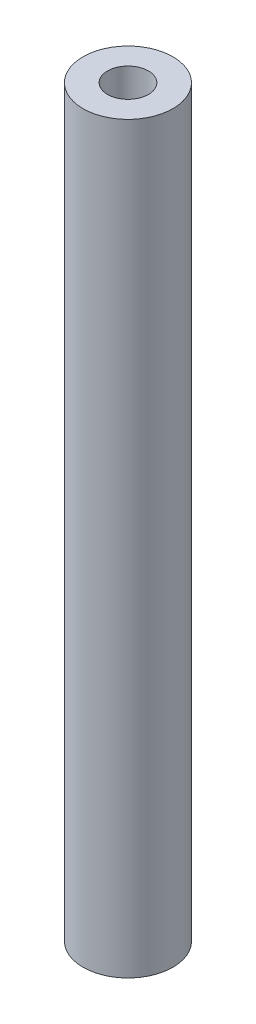
from build123d import *

# Parameters (mm, degrees)
SKETCH1_R           = 5.5
SKETCH1_R_2         = 2.5
BOSS_EXTRUDE1_DEPTH = 91


with BuildPart() as part:
    # Sketch1 → Boss-Extrude1 (new body)
    with BuildSketch(Plane(origin=(0, 0, 0), x_dir=(1, 0, 0), z_dir=(0, 1, 0))):
        Circle(SKETCH1_R)
        Circle(SKETCH1_R_2, mode=Mode.SUBTRACT)
    extrude(amount=BOSS_EXTRUDE1_DEPTH)


solid = part.part
